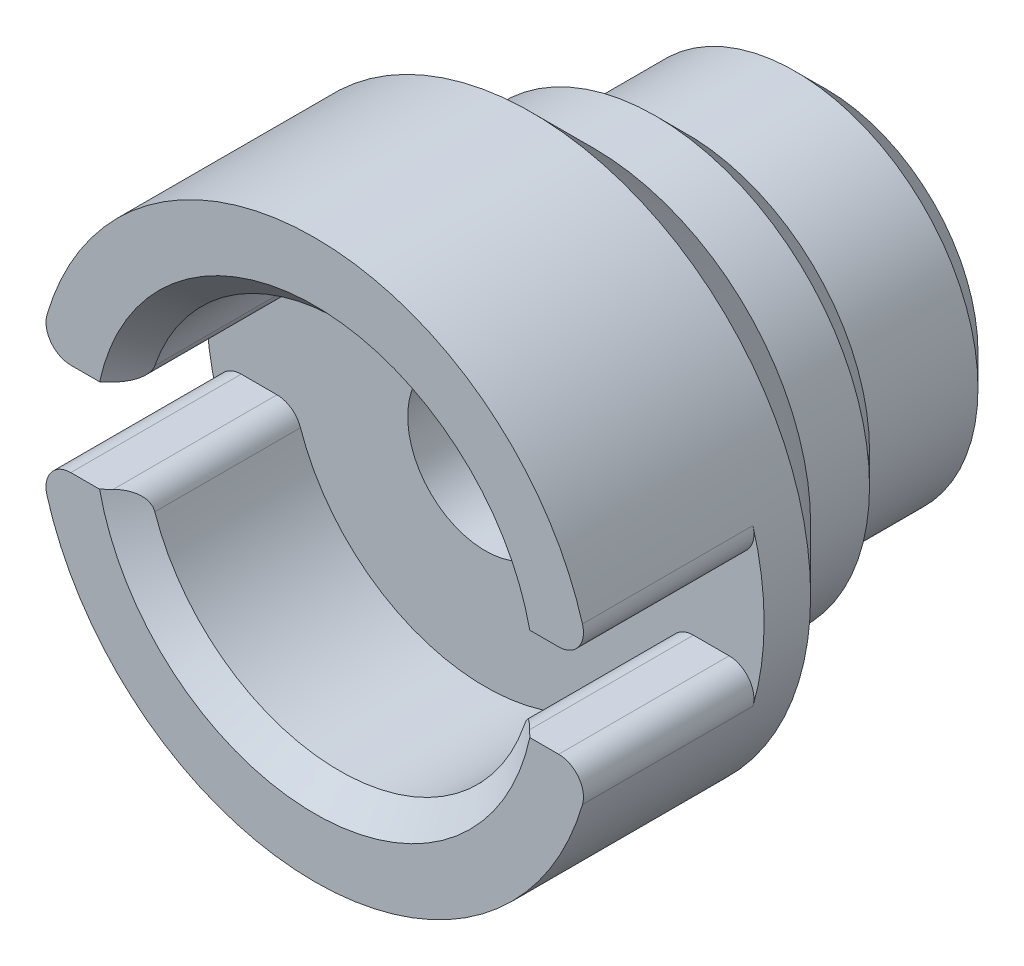
from build123d import *

# Parameters (mm, degrees)
SKETCH1_R           = 2.95
SKETCH1_R_2         = 1.25
BOSS_EXTRUDE1_DEPTH = 3.75
SKETCH2_R           = 4.5
SKETCH2_R_2         = 1.25
BOSS_EXTRUDE2_DEPTH = 4.5
SKETCH3_R           = 3.15
CUT_EXTRUDE1_DEPTH  = 2.75
CHAMFER1_SIZE       = 0.4
CHAMFER2_SIZE       = 0.5
BOSS_EXTRUDE3_START = 1.5
SKETCH4_R           = 3.45
SKETCH4_R_2         = 1.25
BOSS_EXTRUDE3_DEPTH = 1.5
CHAMFER3_SIZE       = 1
CHAMFER6_SIZE       = 0.5
CUT_EXTRUDE2_REACH  = 12.419
SKETCH5_W           = 12.167806538
SKETCH5_H           = 1.5
FILLET1_R           = 0.4


with BuildPart() as part:
    # Sketch1 → Boss-Extrude1 (new body)
    with BuildSketch(Plane.XY):
        Circle(SKETCH1_R)
        Circle(SKETCH1_R_2, mode=Mode.SUBTRACT)
    extrude(amount=BOSS_EXTRUDE1_DEPTH)

    # Sketch2 → Boss-Extrude2 (add)
    with BuildSketch(Plane.XY.offset(3.75)):
        Circle(SKETCH2_R)
        Circle(SKETCH2_R_2, mode=Mode.SUBTRACT)
    extrude(amount=BOSS_EXTRUDE2_DEPTH)

    # Sketch3 → Cut-Extrude1 (cut)
    with BuildSketch(Plane.XY.offset(8.25)):
        Circle(SKETCH3_R)
    extrude(amount=-CUT_EXTRUDE1_DEPTH, mode=Mode.SUBTRACT)

    # Chamfer1
    chamfer1_edges = [part.edges().sort_by_distance(p)[0] for p in [
        (-3.15, 0, 8.25),
    ]]
    chamfer(chamfer1_edges, length=CHAMFER1_SIZE)

    # Chamfer2
    chamfer2_edges = [part.edges().sort_by_distance(p)[0] for p in [
        (-2.95, 0, 0),
    ]]
    chamfer(chamfer2_edges, length=CHAMFER2_SIZE)

    # Sketch4 → Boss-Extrude3 (add)
    with BuildSketch(Plane(origin=(0, 0, 3.75), x_dir=(-1, 0, 0), z_dir=(0, 0, -1)).offset(BOSS_EXTRUDE3_START)):
        with Locations(Location((0, 0, 0), (0, 0, 180))):
            Circle(SKETCH4_R)
        with Locations(Location((0, 0, 0), (0, 0, 180))):
            Circle(SKETCH4_R_2, mode=Mode.SUBTRACT)
    extrude(amount=-BOSS_EXTRUDE3_DEPTH)

    # Chamfer3
    chamfer3_edges = [part.edges().sort_by_distance(p)[0] for p in [
        (-4.5, 0, 3.75),
    ]]
    chamfer(chamfer3_edges, length=CHAMFER3_SIZE)

    # Chamfer6
    chamfer6_edges = [part.edges().sort_by_distance(p)[0] for p in [
        (-3.45, 0, 2.25),
    ]]
    chamfer(chamfer6_edges, length=CHAMFER6_SIZE - 0.0001)  # a hair under: the kernel refuses the full size

    # Cut-Extrude2: up to this face of the body (flat: up to its plane)
    cut_extrude2_end = Plane(part.part.faces().sort_by_distance((-3.060904546, 0, 5.5))[0])
    # Sketch5 → Cut-Extrude2 (cut, up to the picked face)
    with BuildSketch(Plane.XY.offset(8.25), mode=Mode.PRIVATE) as cut_extrude2_sk1:
        Rectangle(SKETCH5_W, SKETCH5_H)
    cut_extrude2_tool1 = split(extrude(cut_extrude2_sk1.sketch, amount=-CUT_EXTRUDE2_REACH, mode=Mode.PRIVATE), bisect_by=cut_extrude2_end, keep=Keep.BOTH, mode=Mode.PRIVATE)
    add(cut_extrude2_tool1.solids().sort_by(Axis((0, 0, 8.25), (0, 0, -1)))[0], mode=Mode.SUBTRACT)

    # Fillet1
    fillet1_edges = [part.edges().sort_by_distance(p)[0] for p in [
        (3.059411708, -0.75, 6.675),
        (-3.059411708, -0.75, 6.675),
        (4.437059837, -0.75, 6.875),
        (-4.437059837, -0.75, 6.875),
        (-3.059411708, 0.75, 6.675),
        (3.059411708, 0.75, 6.675),
        (-4.437059837, 0.75, 6.875),
        (4.437059837, 0.75, 6.875),
    ]]
    fillet(fillet1_edges, radius=FILLET1_R)


solid = part.part
